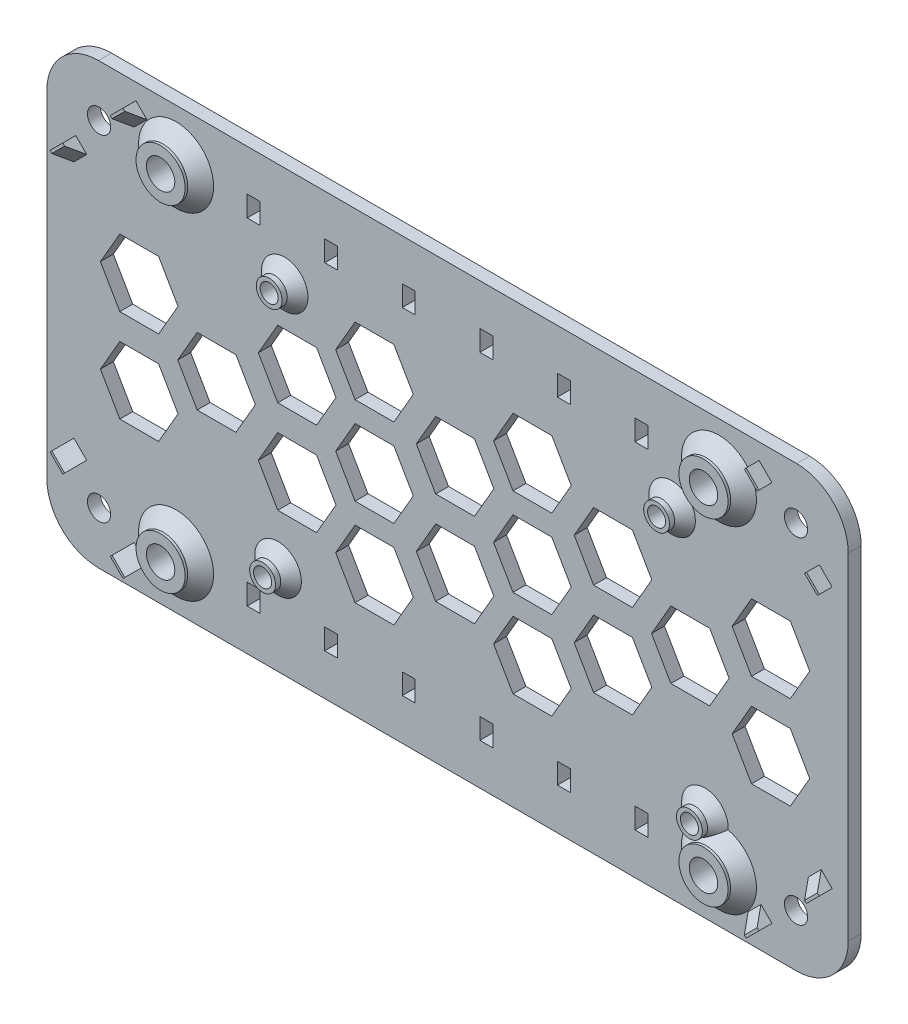
from build123d import *

# Parameters (mm, degrees)
MAIN_DEPTH            = 2.5
SKETCH2_R             = 2.25
CORNER_SCREW_DEPTH    = 3
MOUNT_PLACE_R         = 4.75
MOUNT_SCREW_DEPTH     = 3
SKETCH9_R             = 2.5
BOARD_SCREW_DEPTH     = 3
CHAMFER1_SIZE         = 2.5
SKETCH5_R             = 2.75
MOUNT_HOLE_DEPTH      = 6
SKETCH8_R             = 1.75
BOARD_HOLE_DEPTH      = 6
CHAMFER2_SIZE         = 2
NUTS_DEPTH            = 2.5
CORNER_STOPPERS_DEPTH = 2.5
CHAMFER3_SIZE         = 2.5
DECOR_DEPTH           = 3
SKETCH17_W            = 2.5
SKETCH17_H            = 4
WIRE_HOLES_DEPTH      = 4


# Some blends are built 0.0001 mm under size
with BuildPart() as part:
    # Sketch1 → main (new body)
    with BuildSketch(Plane.XY):
        with BuildLine():
            Line((-70, 42.5), (65, 42.5))
            ThreePointArc((65, 42.5), (72.071067812, 39.571067812), (75, 32.5))
            Line((75, 32.5), (75, -32.5))
            ThreePointArc((75, -32.5), (72.071067812, -39.571067812), (65, -42.5))
            Line((65, -42.5), (-70, -42.5))
            ThreePointArc((-70, -42.5), (-77.071067812, -39.571067812), (-80, -32.5))
            Line((-80, -32.5), (-80, 32.5))
            ThreePointArc((-80, 32.5), (-77.071067812, 39.571067812), (-70, 42.5))
        make_face()
    extrude(amount=MAIN_DEPTH)

    # Sketch2 → corner_screw (cut)
    with BuildSketch(Plane.XY):
        with Locations((-69.9, -32.4)):
            Circle(SKETCH2_R)
        with Locations((-69.9, 32.5)):
            Circle(SKETCH2_R)
        with Locations((64.9, 32.5)):
            Circle(SKETCH2_R)
        with Locations((64.9, -32.4)):
            Circle(SKETCH2_R)
    extrude(amount=CORNER_SCREW_DEPTH, mode=Mode.SUBTRACT)

    # mount_place → mount_screw (add)
    with BuildSketch(Plane.XY.offset(2.5)):
        with Locations((-55, 32.5)):
            Circle(MOUNT_PLACE_R)
        with Locations((50, 32.5)):
            Circle(MOUNT_PLACE_R)
        with Locations((50, -32.5)):
            Circle(MOUNT_PLACE_R)
        with Locations((-55, -32.5)):
            Circle(MOUNT_PLACE_R)
    extrude(amount=MOUNT_SCREW_DEPTH)

    # Sketch9 → board_screw (add)
    with BuildSketch(Plane.XY.offset(2.5)):
        with Locations((-33.996997662, 23.059689104)):
            Circle(SKETCH9_R)
        with Locations((40.933002338, 23.059689104)):
            Circle(SKETCH9_R)
        with Locations((47.283002338, -25.200310896)):
            Circle(SKETCH9_R)
        with Locations((-35.266997662, -25.200310896)):
            Circle(SKETCH9_R)
    extrude(amount=BOARD_SCREW_DEPTH)

    # Chamfer1
    # the kernel refuses this chamfer: 2.5 mm, written as the material it adds along each edge
    with BuildSketch(Plane(origin=(-55, 32.5, 2.5), x_dir=(1, 0, 0), z_dir=(0, -1, 0))) as chamfer1_piece_1:
        Polygon((4.75 + CHAMFER1_SIZE, 0), (4.75, CHAMFER1_SIZE), (4.75, 0), align=None)
    revolve(axis=Axis((-55, 32.5, 2.5), (0, 0, 1)))
    with BuildSketch(Plane(origin=(50, 32.5, 2.5), x_dir=(1, 0, 0), z_dir=(0, -1, 0))) as chamfer1_piece_2:
        Polygon((4.75 + CHAMFER1_SIZE, 0), (4.75, CHAMFER1_SIZE), (4.75, 0), align=None)
    revolve(axis=Axis((50, 32.5, 2.5), (0, 0, 1)))
    with BuildSketch(Plane(origin=(50, -32.5, 2.5), x_dir=(1, 0, 0), z_dir=(0, -1, 0))) as chamfer1_piece_3:
        Polygon((4.75 + CHAMFER1_SIZE, 0), (4.75, CHAMFER1_SIZE), (4.75, 0), align=None)
    revolve(axis=Axis((50, -32.5, 2.5), (0, 0, 1)))
    with BuildSketch(Plane(origin=(-55, -32.5, 2.5), x_dir=(1, 0, 0), z_dir=(0, -1, 0))) as chamfer1_piece_4:
        Polygon((4.75 + CHAMFER1_SIZE, 0), (4.75, CHAMFER1_SIZE), (4.75, 0), align=None)
    revolve(axis=Axis((-55, -32.5, 2.5), (0, 0, 1)))

    # Sketch5 → mount hole (cut)
    with BuildSketch(Plane.XY.offset(5.5)):
        with Locations((-55, 32.5)):
            Circle(SKETCH5_R)
        with Locations((50, 32.5)):
            Circle(SKETCH5_R)
        with Locations((-55, -32.5)):
            Circle(SKETCH5_R)
        with Locations((50, -32.5)):
            Circle(SKETCH5_R)
    extrude(amount=-MOUNT_HOLE_DEPTH, mode=Mode.SUBTRACT)

    # Sketch8 → board_hole (cut)
    with BuildSketch(Plane(origin=(0, 0, 0), x_dir=(-1, 0, 0), z_dir=(0, 0, -1))):
        with Locations((-40.933002338, 23.059689104)):
            Circle(SKETCH8_R)
        with Locations((33.996997662, 23.059689104)):
            Circle(SKETCH8_R)
        with Locations((35.266997662, -25.200310896)):
            Circle(SKETCH8_R)
        with Locations((-47.283002338, -25.200310896)):
            Circle(SKETCH8_R)
    extrude(amount=-BOARD_HOLE_DEPTH, mode=Mode.SUBTRACT)

    # Chamfer2
    # the kernel refuses this chamfer: 2 mm, written as the material it adds along each edge
    with BuildSketch(Plane(origin=(47.283002338, -25.200310896, 2.5), x_dir=(1, 0, 0), z_dir=(0, -1, 0))) as chamfer2_piece_1:
        Polygon((2.5 + CHAMFER2_SIZE, 0), (2.5, CHAMFER2_SIZE), (2.5, 0), align=None)
    revolve(axis=Axis((47.283002338, -25.200310896, 2.5), (0, 0, 1)), revolution_arc=340.210885204)
    with BuildSketch(Plane(origin=(40.933002338, 23.059689104, 2.5), x_dir=(1, 0, 0), z_dir=(0, -1, 0))) as chamfer2_piece_2:
        Polygon((2.5 + CHAMFER2_SIZE, 0), (2.5, CHAMFER2_SIZE), (2.5, 0), align=None)
    revolve(axis=Axis((40.933002338, 23.059689104, 2.5), (0, 0, 1)))
    with BuildSketch(Plane(origin=(-35.266997662, -25.200310896, 2.5), x_dir=(1, 0, 0), z_dir=(0, -1, 0))) as chamfer2_piece_3:
        Polygon((2.5 + CHAMFER2_SIZE, 0), (2.5, CHAMFER2_SIZE), (2.5, 0), align=None)
    revolve(axis=Axis((-35.266997662, -25.200310896, 2.5), (0, 0, 1)))
    with BuildSketch(Plane(origin=(-33.996997662, 23.059689104, 2.5), x_dir=(1, 0, 0), z_dir=(0, -1, 0))) as chamfer2_piece_4:
        Polygon((2.5 + CHAMFER2_SIZE, 0), (2.5, CHAMFER2_SIZE), (2.5, 0), align=None)
    revolve(axis=Axis((-33.996997662, 23.059689104, 2.5), (0, 0, 1)))
    with BuildSketch(Plane(origin=(47.283002338, -25.200310896, 2.5), x_dir=(-0.4861978635597859, -0.8738487497673152, 0), z_dir=(-0.8738487497673152, 0.4861978635597859, 0))) as chamfer2_piece_5:
        Polygon((2.5 + CHAMFER2_SIZE, 0), (2.5, CHAMFER2_SIZE), (2.5, 0), align=None)
    revolve(axis=Axis((47.283002338, -25.200310896, 2.5), (0, 0, 1)), revolution_arc=119.090983015)

    # Sketch10 → nuts (cut)
    with BuildSketch(Plane(origin=(0, 0, 0), x_dir=(-1, 0, 0), z_dir=(0, 0, -1))):
        Polygon((-37.933002338, 21.327638296), (-37.933002338, 24.791739911), (-40.933002338, 26.523790719), (-43.933002338, 24.791739911), (-43.933002338, 21.327638296), (-40.933002338, 19.595587488), align=None)
        Polygon((36.996997662, 21.327638296), (36.996997662, 24.791739911), (33.996997662, 26.523790719), (30.996997662, 24.791739911), (30.996997662, 21.327638296), (33.996997662, 19.595587488), align=None)
        Polygon((35.266997662, -28.664412512), (38.266997662, -26.932361704), (38.266997662, -23.468260089), (35.266997662, -21.736209281), (32.266997662, -23.468260089), (32.266997662, -26.932361704), align=None)
        Polygon((-44.283002338, -26.932361704), (-44.283002338, -23.468260089), (-47.283002338, -21.736209281), (-50.283002338, -23.468260089), (-50.283002338, -26.932361704), (-47.283002338, -28.664412512), align=None)
    extrude(amount=-NUTS_DEPTH, mode=Mode.SUBTRACT)

    # Sketch11 → corner_stoppers (add)
    with BuildSketch(Plane.XY.offset(2.5)):
        Polygon((-65.234654236, -36.911792374), (-62.759780502, -39.386666108), (-60.638460158, -37.265345764), (-63.113333892, -34.79047203), align=None)
        Polygon((-74.411792374, -27.734654236), (-76.886666108, -25.259780502), (-74.765345764, -23.138460158), (-72.29047203, -25.613333892), align=None)
        Polygon((-72.29047203, 25.613333892), (-74.765345764, 23.138460158), (-76.886666108, 25.259780502), (-74.411792374, 27.734654236), align=None)
        Polygon((-63.113333892, 34.79047203), (-60.638460158, 37.265345764), (-62.759780502, 39.386666108), (-65.234654236, 36.911792374), align=None)
        Polygon((60.234654236, 36.911792374), (57.759780502, 39.386666108), (55.638460158, 37.265345764), (58.113333892, 34.79047203), align=None)
        Polygon((69.411792374, 27.734654236), (71.886666108, 25.259780502), (69.765345764, 23.138460158), (67.29047203, 25.613333892), align=None)
        Polygon((67.29047203, -25.613333892), (69.765345764, -23.138460158), (71.886666108, -25.259780502), (69.411792374, -27.734654236), align=None)
        Polygon((58.113333892, -34.79047203), (55.638460158, -37.265345764), (57.759780502, -39.386666108), (60.234654236, -36.911792374), align=None)
    extrude(amount=CORNER_STOPPERS_DEPTH)

    # Chamfer3
    chamfer3_edges = [part.edges().sort_by_distance(p)[0] for p in [
        (68.527908897, -24.375897025, 5),
        (56.875897025, -36.027908897, 5),
        (56.875897025, 36.027908897, 5),
        (68.527908897, 24.375897025, 5),
        (-61.875897025, -36.027908897, 5),
        (-73.527908897, 24.375897025, 5),
        (-73.527908897, -24.375897025, 5),
        (-61.875897025, 36.027908897, 5),
    ]]
    chamfer(chamfer3_edges, length=CHAMFER3_SIZE - 0.0001)  # a hair under: the kernel refuses the full size

    # Sketch16 → decor (cut)
    with BuildSketch(Plane.XY.offset(2.5)):
        Polygon((51.961748971, 0), (48.208972221, 6.5), (40.703418721, 6.5), (36.950641972, 0), (40.703418721, -6.5), (48.208972221, -6.5), align=None)
        Polygon((67.550206239, 9), (63.797429489, 15.5), (56.291875989, 15.5), (52.53909924, 9), (56.291875989, 2.5), (63.797429489, 2.5), align=None)
        Polygon((67.550206239, -9), (63.797429489, -2.5), (56.291875989, -2.5), (52.53909924, -9), (56.291875989, -15.5), (63.797429489, -15.5), align=None)
        Polygon((21.417944442, 0), (17.665167692, 6.5), (10.159614192, 6.5), (6.406837443, 0), (10.159614192, -6.5), (17.665167692, -6.5), align=None)
        Polygon((37.00640171, 9), (33.25362496, 15.5), (25.748071461, 15.5), (21.995294711, 9), (25.748071461, 2.5), (33.25362496, 2.5), align=None)
        Polygon((37.00640171, -9), (33.25362496, -2.5), (25.748071461, -2.5), (21.995294711, -9), (25.748071461, -15.5), (33.25362496, -15.5), align=None)
        Polygon((-9.125860087, 0), (-12.878636837, 6.5), (-20.384190336, 6.5), (-24.136967086, 0), (-20.384190336, -6.5), (-12.878636837, -6.5), align=None)
        Polygon((6.462597181, 9), (2.709820431, 15.5), (-4.795733068, 15.5), (-8.548509818, 9), (-4.795733068, 2.5), (2.709820431, 2.5), align=None)
        Polygon((6.462597181, -9), (2.709820431, -2.5), (-4.795733068, -2.5), (-8.548509818, -9), (-4.795733068, -15.5), (2.709820431, -15.5), align=None)
        Polygon((-39.669664616, 0), (-43.422441366, 6.5), (-50.927994865, 6.5), (-54.680771615, 0), (-50.927994865, -6.5), (-43.422441366, -6.5), align=None)
        Polygon((-24.081207348, 9), (-27.833984098, 15.5), (-35.339537597, 15.5), (-39.092314347, 9), (-35.339537597, 2.5), (-27.833984098, 2.5), align=None)
        Polygon((-24.081207348, -9), (-27.833984098, -2.5), (-35.339537597, -2.5), (-39.092314347, -9), (-35.339537597, -15.5), (-27.833984098, -15.5), align=None)
        Polygon((-54.625011877, 9), (-58.377788627, 15.5), (-65.883342126, 15.5), (-69.636118876, 9), (-65.883342126, 2.5), (-58.377788627, 2.5), align=None)
        Polygon((-54.625011877, -9), (-58.377788627, -2.5), (-65.883342126, -2.5), (-69.636118876, -9), (-65.883342126, -15.5), (-58.377788627, -15.5), align=None)
        Polygon((-24.136967086, 17), (-20.384190336, 10.5), (-12.878636837, 10.5), (-9.125860087, 17), (-12.878636837, 23.5), (-20.384190336, 23.5), align=None)
        Polygon((10.159614192, 23.5), (6.406837443, 17), (10.159614192, 10.5), (17.665167692, 10.5), (21.417944442, 17), (17.665167692, 23.5), align=None)
        Polygon((21.417944442, -17), (17.665167692, -10.5), (10.159614192, -10.5), (6.406837443, -17), (10.159614192, -23.5), (17.665167692, -23.5), align=None)
        Polygon((-9.125860087, -17), (-12.878636837, -10.5), (-20.384190336, -10.5), (-24.136967086, -17), (-20.384190336, -23.5), (-12.878636837, -23.5), align=None)
    extrude(amount=-DECOR_DEPTH, mode=Mode.SUBTRACT)

    # Sketch17 → wire_holes (cut)
    with BuildSketch(Plane.XY.offset(2.5)):
        with Locations((20, 32.5)):
            Rectangle(SKETCH17_W, SKETCH17_H)
        with Locations((35, 32.5)):
            Rectangle(SKETCH17_W, SKETCH17_H)
        with Locations((5, 32.5)):
            Rectangle(SKETCH17_W, SKETCH17_H)
        with Locations((-10, 32.5)):
            Rectangle(SKETCH17_W, SKETCH17_H)
        with Locations((-25, 32.5)):
            Rectangle(SKETCH17_W, SKETCH17_H)
        with Locations((-40, 32.5)):
            Rectangle(SKETCH17_W, SKETCH17_H)
        with Locations((20, -32.5)):
            Rectangle(SKETCH17_W, SKETCH17_H)
        with Locations((35, -32.5)):
            Rectangle(SKETCH17_W, SKETCH17_H)
        with Locations((5, -32.5)):
            Rectangle(SKETCH17_W, SKETCH17_H)
        with Locations((-10, -32.5)):
            Rectangle(SKETCH17_W, SKETCH17_H)
        with Locations((-25, -32.5)):
            Rectangle(SKETCH17_W, SKETCH17_H)
        with Locations((-40, -32.5)):
            Rectangle(SKETCH17_W, SKETCH17_H)
    extrude(amount=-WIRE_HOLES_DEPTH, mode=Mode.SUBTRACT)


solid = part.part
